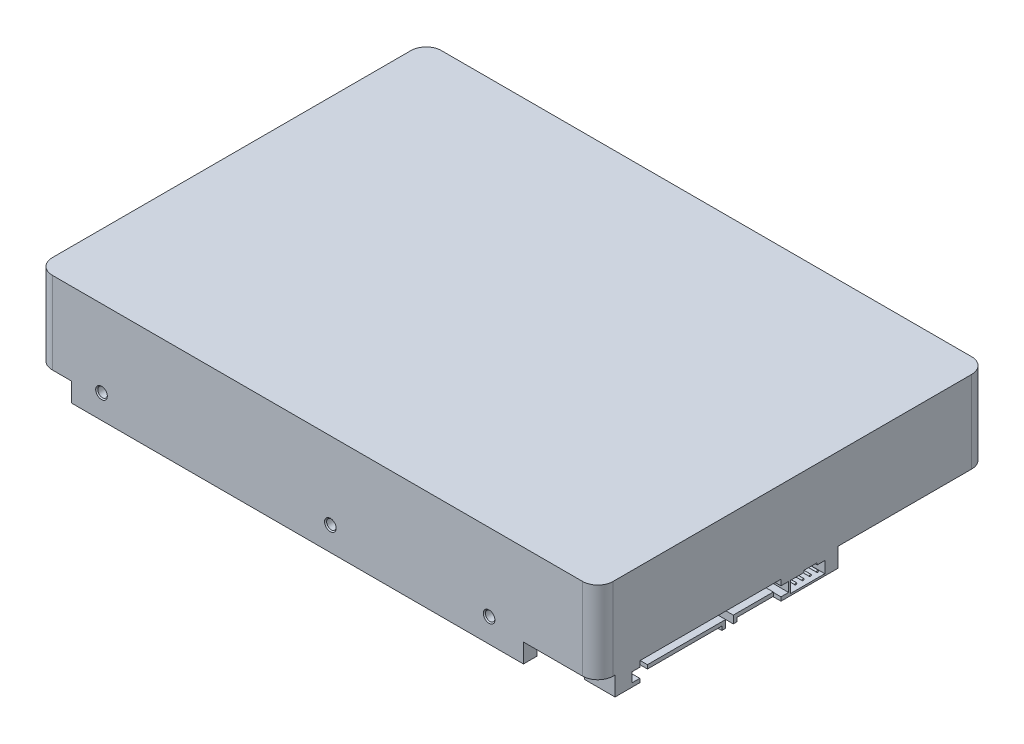
from build123d import *

# Parameters (mm, degrees)
SKETCH_2_W                  = 147
SKETCH_2_H                  = 102
EXTRUDE_1_DEPTH             = 26.5
SKETCH_4_W                  = 6
SKETCH_4_H                  = 3
CUT_EXTRUDE_2_DEPTH         = 9
PATTERN_LINEAR_1_COUNT      = 2
PATTERN_LINEAR_1_PITCH      = 41.61
PATTERN_LINEAR_1_COL_COUNT  = 2
PATTERN_LINEAR_1_COL_PITCH  = 101.6
MIRROR_1_COPY_1_SKETCH_W    = 6
MIRROR_1_COPY_1_SKETCH_H    = 3
MIRROR_1_COPY_1_DEPTH       = 9
MIRROR_1_COPY_2_SKETCH_W    = 6
MIRROR_1_COPY_2_SKETCH_H    = 3
MIRROR_1_COPY_2_DEPTH       = 9
HOLE_WIZARD_M3_1_AT_2_COUNT = 2
HOLE_WIZARD_M3_1_AT_2_PITCH = 37.773753222
PATTERN_LINEAR_2_COUNT      = 2
PATTERN_LINEAR_2_PITCH      = 41.61
PATTERN_LINEAR_2_COL_COUNT  = 2
PATTERN_LINEAR_2_COL_PITCH  = 101.6
PATTERN_LINEAR_4_COUNT      = 2
PATTERN_LINEAR_4_PITCH      = 44.45
PATTERN_LINEAR_4_COUNT_DIR2 = 2
PATTERN_LINEAR_4_PITCH_DIR2 = 95
SKETCH_3_W                  = 9
SKETCH_3_H                  = 5
CUT_EXTRUDE_1_DEPTH         = 129.485407732
CUT_EXTRUDE_8_DEPTH         = 5
CUT_EXTRUDE_9_DEPTH         = 0.5
SKETCH_12_W                 = 5
SKETCH_12_H                 = 37
CUT_EXTRUDE_10_DEPTH        = 5
SKETCH_13_W                 = 3
SKETCH_13_H                 = 2.5
CUT_EXTRUDE_11_DEPTH        = 8
EXTRUDE_2_DEPTH             = 5
CUT_EXTRUDE_12_DEPTH        = 5
SKETCH_16_W                 = 4.5
SKETCH_16_H                 = 1
EXTRUDE_3_DEPTH             = 0.1
PATTERN_LINEAR_5_COUNT      = 15
PATTERN_LINEAR_5_PITCH      = 1.3
SKETCH_17_W                 = 4.5
SKETCH_17_H                 = 1
EXTRUDE_4_DEPTH             = 0.1
PATTERN_LINEAR_6_COUNT      = 7
PATTERN_LINEAR_6_PITCH      = 1.3
SKETCH_18_R                 = 0.25
EXTRUDE_5_DEPTH             = 5
PATTERN_LINEAR_7_COUNT      = 4
PATTERN_LINEAR_7_PITCH      = 1.9
FILLET_1_R                  = 4
CHAMFER_1_SIZE              = 0.1


with BuildPart() as part:
    # 草图2 → 凸台-拉伸1 (new body)
    with BuildSketch(Plane(origin=(0, 0, 0), x_dir=(1, 0, 0), z_dir=(0, 1, 0))):
        Rectangle(SKETCH_2_W, SKETCH_2_H)
    extrude(amount=EXTRUDE_1_DEPTH)

    # 草图4 → 切除-拉伸2 (cut)
    with BuildSketch(Plane.XZ):
        with Locations((45, 46)):
            Rectangle(SKETCH_4_W, SKETCH_4_H)
    cut_extrude_2 = extrude(amount=-CUT_EXTRUDE_2_DEPTH, mode=Mode.SUBTRACT)

    # 阵列(线性)1: 切除-拉伸2 ×2
    with Locations(*[(-i * PATTERN_LINEAR_1_PITCH, 0, 0) for i in range(1, PATTERN_LINEAR_1_COUNT)]):
        add(cut_extrude_2, mode=Mode.SUBTRACT)

    # 阵列(线性)1 col: 切除-拉伸2 ×2
    with Locations(*[(-i * PATTERN_LINEAR_1_COL_PITCH, 0, 0) for i in range(1, PATTERN_LINEAR_1_COL_COUNT)]):
        add(cut_extrude_2, mode=Mode.SUBTRACT)

    # 镜向1: 切除-拉伸2 across plane
    add(cut_extrude_2.mirror(Plane.XY), mode=Mode.SUBTRACT)

    # 镜向1 copy 1 sketch → 镜向1 copy 1 (cut)
    with BuildSketch(Plane(origin=(-41.61, 0, 0), x_dir=(1, 0, 0), z_dir=(0, -1, 0))):
        with Locations((45, -46)):
            Rectangle(MIRROR_1_COPY_1_SKETCH_W, MIRROR_1_COPY_1_SKETCH_H)
    extrude(amount=-MIRROR_1_COPY_1_DEPTH, mode=Mode.SUBTRACT)

    # 镜向1 copy 2 sketch → 镜向1 copy 2 (cut)
    with BuildSketch(Plane(origin=(-101.6, 0, 0), x_dir=(1, 0, 0), z_dir=(0, -1, 0))):
        with Locations((45, -46)):
            Rectangle(MIRROR_1_COPY_2_SKETCH_W, MIRROR_1_COPY_2_SKETCH_H)
    extrude(amount=-MIRROR_1_COPY_2_DEPTH, mode=Mode.SUBTRACT)

    # 草图6 → M3 螺纹孔1 (revolve, cut)
    with BuildSketch(Plane(origin=(45, 6.25, 51), x_dir=(0, -1, 0), z_dir=(1, 0, 0))):
        Polygon((0, 0), (0, 4.751075774), (1.25, 4), (1.25, 0.275), (1.525, 0), align=None)
    hole_wizard_m3_1 = revolve(axis=Axis((45, 6.25, 57.35), (0, 0, -1)), mode=Mode.SUBTRACT)

    # M3 螺纹孔1 at 2: M3 螺纹孔1 ×2
    with Locations(*[Vector(0.07684027129931902, 0.9970434156578374, 0) * (i * HOLE_WIZARD_M3_1_AT_2_PITCH) for i in range(1, HOLE_WIZARD_M3_1_AT_2_COUNT)]):
        add(hole_wizard_m3_1, mode=Mode.SUBTRACT)

    # 阵列(线性)2: M3 螺纹孔1 ×2
    with Locations(*[(-i * PATTERN_LINEAR_2_PITCH, 0, 0) for i in range(1, PATTERN_LINEAR_2_COUNT)]):
        add(hole_wizard_m3_1, mode=Mode.SUBTRACT)

    # 阵列(线性)2 copy 1 sketch → 阵列(线性)2 copy 1 (revolve, cut)
    with BuildSketch(Plane(origin=(6.292545446, 43.912071935, 51), x_dir=(0, -1, 0), z_dir=(1, 0, 0))):
        Polygon((0, 0), (0, 4.751075774), (1.25, 4), (1.25, 0.275), (1.525, 0), align=None)
    revolve(axis=Axis((6.292545446, 43.912071935, 57.35), (0, 0, -1)), mode=Mode.SUBTRACT)

    # 阵列(线性)2 col: M3 螺纹孔1 ×2
    with Locations(*[(-i * PATTERN_LINEAR_2_COL_PITCH, 0, 0) for i in range(1, PATTERN_LINEAR_2_COL_COUNT)]):
        add(hole_wizard_m3_1, mode=Mode.SUBTRACT)

    # 阵列(线性)2 col copy 1 sketch → 阵列(线性)2 col copy 1 (revolve, cut)
    with BuildSketch(Plane(origin=(-53.697454554, 43.912071935, 51), x_dir=(0, -1, 0), z_dir=(1, 0, 0))):
        Polygon((0, 0), (0, 4.751075774), (1.25, 4), (1.25, 0.275), (1.525, 0), align=None)
    revolve(axis=Axis((-53.697454554, 43.912071935, 57.35), (0, 0, -1)), mode=Mode.SUBTRACT)

    # 镜向2: M3 螺纹孔1 across plane
    add(hole_wizard_m3_1.mirror(Plane.XY), mode=Mode.SUBTRACT)

    # 镜向2 copy 1 sketch → 镜向2 copy 1 (revolve, cut)
    with BuildSketch(Plane(origin=(47.902545446, 43.912071935, -51), x_dir=(0, -1, 0), z_dir=(1, 0, 0))):
        Polygon((0, 0), (0, -4.751075774), (1.25, -4), (1.25, -0.275), (1.525, 0), align=None)
    revolve(axis=Axis((47.902545446, 43.912071935, -57.35), (0, 0, -1)), mode=Mode.SUBTRACT)

    # 镜向2 copy 2 sketch → 镜向2 copy 2 (revolve, cut)
    with BuildSketch(Plane(origin=(3.39, 6.25, -51), x_dir=(0, -1, 0), z_dir=(1, 0, 0))):
        Polygon((0, 0), (0, -4.751075774), (1.25, -4), (1.25, -0.275), (1.525, 0), align=None)
    revolve(axis=Axis((3.39, 6.25, -57.35), (0, 0, -1)), mode=Mode.SUBTRACT)

    # 镜向2 copy 3 sketch → 镜向2 copy 3 (revolve, cut)
    with BuildSketch(Plane(origin=(6.292545446, 43.912071935, -51), x_dir=(0, -1, 0), z_dir=(1, 0, 0))):
        Polygon((0, 0), (0, -4.751075774), (1.25, -4), (1.25, -0.275), (1.525, 0), align=None)
    revolve(axis=Axis((6.292545446, 43.912071935, -57.35), (0, 0, -1)), mode=Mode.SUBTRACT)

    # 镜向2 copy 4 sketch → 镜向2 copy 4 (revolve, cut)
    with BuildSketch(Plane(origin=(-56.6, 6.25, -51), x_dir=(0, -1, 0), z_dir=(1, 0, 0))):
        Polygon((0, 0), (0, -4.751075774), (1.25, -4), (1.25, -0.275), (1.525, 0), align=None)
    revolve(axis=Axis((-56.6, 6.25, -57.35), (0, 0, -1)), mode=Mode.SUBTRACT)

    # 镜向2 copy 5 sketch → 镜向2 copy 5 (revolve, cut)
    with BuildSketch(Plane(origin=(-53.697454554, 43.912071935, -51), x_dir=(0, -1, 0), z_dir=(1, 0, 0))):
        Polygon((0, 0), (0, -4.751075774), (1.25, -4), (1.25, -0.275), (1.525, 0), align=None)
    revolve(axis=Axis((-53.697454554, 43.912071935, -57.35), (0, 0, -1)), mode=Mode.SUBTRACT)

    # 草图9 → M3 螺纹孔2 (revolve, cut)
    with BuildSketch(Plane(origin=(32.22, 0, 47.5), x_dir=(0, 0, -1), z_dir=(1, 0, 0))):
        Polygon((0, 0), (0, 10.751075774), (1.25, 10), (1.25, 0.275), (1.525, 0), align=None)
    hole_wizard_m3_2 = revolve(axis=Axis((32.22, -6.35, 47.5), (0, 1, 0)), mode=Mode.SUBTRACT)

    # 阵列(线性)4: Hole Wizard M3 _2 2 × 2
    with Locations(*[(-i * PATTERN_LINEAR_4_PITCH, 0, -j * PATTERN_LINEAR_4_PITCH_DIR2) for i in range(PATTERN_LINEAR_4_COUNT) for j in range(PATTERN_LINEAR_4_COUNT_DIR2) if (i, j) != (0, 0)]):
        add(hole_wizard_m3_2, mode=Mode.SUBTRACT)

    # 草图3 → 切除-拉伸1 (cut, through all)
    with BuildSketch(Plane.XY.offset(51)):
        with Locations((-69, 2.5)):
            Rectangle(SKETCH_3_W, SKETCH_3_H)
    extrude(amount=-CUT_EXTRUDE_1_DEPTH, mode=Mode.SUBTRACT)

    # 草图10 → 切除-拉伸8 (cut)
    with BuildSketch(Plane.XZ):
        with BuildLine():
            Line((-64.5, 47.5), (-15.73, 47.5))
            ThreePointArc((-15.73, 47.5), (-12.23, 44), (-8.73, 47.5))
            Line((-8.73, 47.5), (4.246353463, 47.5))
            Line((4.246353463, 47.5), (28.72, 47.5))
            ThreePointArc((28.72, 47.5), (32.22, 44), (35.72, 47.5))
            Line((35.72, 47.5), (54, 47.5))
            Line((54, 47.5), (54, 51))
            Line((54, 51), (73.5, 51))
            Line((73.5, 51), (73.5, 46.5))
            Line((73.5, 46.5), (36.607482194, 46.5))
            ThreePointArc((36.607482194, 46.5), (32.22, 43), (27.832517806, 46.5))
            Line((27.832517806, 46.5), (7.5, 46.5))
            Line((7.5, 46.5), (7.5, -34.5))
            Line((7.5, -34.5), (32.5, -34.5))
            Line((32.5, -34.5), (38.5, -28.5))
            Line((38.5, -28.5), (65.5, -28.5))
            Line((65.5, -28.5), (65.5, -12))
            Line((65.5, -12), (73.5, -12))
            Line((73.5, -12), (73.5, -51))
            Line((73.5, -51), (54, -51))
            Line((54, -51), (54, -47.5))
            Line((54, -47.5), (35.72, -47.5))
            ThreePointArc((35.72, -47.5), (32.22, -44), (28.72, -47.5))
            Line((28.72, -47.5), (-8.73, -47.5))
            ThreePointArc((-8.73, -47.5), (-12.23, -44), (-15.73, -47.5))
            Line((-15.73, -47.5), (-64.5, -47.5))
            Line((-64.5, -47.5), (-64.5, 47.5))
        make_face()
    extrude(amount=-CUT_EXTRUDE_8_DEPTH, mode=Mode.SUBTRACT)

    # 草图11 → 切除-拉伸9 (cut)
    with BuildSketch(Plane.XZ):
        with BuildLine():
            Line((65.5, 46.5), (36.607482194, 46.5))
            ThreePointArc((36.607482194, 46.5), (32.22, 43), (27.832517806, 46.5))
            Line((27.832517806, 46.5), (7.5, 46.5))
            Line((7.5, 46.5), (7.5, -34.5))
            Line((7.5, -34.5), (65.5, -34.5))
            Line((65.5, -34.5), (65.5, -12))
            Line((65.5, -12), (61.5, -12))
            Line((61.5, -12), (61.5, -9.5))
            Line((61.5, -9.5), (65.5, -9.5))
            Line((65.5, -9.5), (65.5, -0.5))
            Line((65.5, -0.5), (61.5, -0.5))
            Line((61.5, -0.5), (61.5, 3))
            Line((61.5, 3), (65.5, 3))
            Line((65.5, 3), (65.5, 15.5))
            Line((65.5, 15.5), (64, 15.5))
            Line((64, 15.5), (64, 17.5))
            Line((64, 17.5), (65.5, 17.5))
            Line((65.5, 17.5), (65.5, 38.5))
            Line((65.5, 38.5), (61.5, 38.5))
            Line((61.5, 38.5), (61.5, 42.5))
            Line((61.5, 42.5), (65.5, 42.5))
            Line((65.5, 42.5), (65.5, 46.5))
        make_face()
    extrude(amount=-CUT_EXTRUDE_9_DEPTH, mode=Mode.SUBTRACT)

    # 草图12 → 切除-拉伸10 (cut)
    with BuildSketch(Plane.XZ):
        with Locations((71, 21.5)):
            Rectangle(SKETCH_12_W, SKETCH_12_H)
    extrude(amount=-CUT_EXTRUDE_10_DEPTH, mode=Mode.SUBTRACT)

    # 草图13 → 切除-拉伸11 (cut)
    with BuildSketch(Plane(origin=(73.5, 0, 0), x_dir=(0, 0, -1), z_dir=(1, 0, 0))):
        with Locations((-40.5, 2.25)):
            Rectangle(SKETCH_13_W, SKETCH_13_H)
        with Locations((-2.5, 2.25)):
            Rectangle(SKETCH_13_W, SKETCH_13_H)
    extrude(amount=-CUT_EXTRUDE_11_DEPTH, mode=Mode.SUBTRACT)

    # 草图14 → 凸台-拉伸2 (add)
    with BuildSketch(Plane(origin=(68.5, 0, 0), x_dir=(0, 0, -1), z_dir=(1, 0, 0))):
        Polygon((-15.5, 3.1), (-5, 3.1), (-5, 2.1), (-14.5, 2.1), (-14.5, 1.1), (-15.5, 1.1), align=None)
        Polygon((-38, 3.1), (-17.5, 3.1), (-17.5, 1.1), (-18.5, 1.1), (-18.5, 2.1), (-38, 2.1), align=None)
    extrude(amount=EXTRUDE_2_DEPTH)

    # 草图15 → 切除-拉伸12 (cut)
    with BuildSketch(Plane(origin=(73.5, 0, 0), x_dir=(0, 0, -1), z_dir=(1, 0, 0))):
        Polygon((6.5, 3.5), (8.5, 3.5), (8.5, 0.5), (-0.5, 0.5), (-0.5, 3.5), (3, 3.5), (3, 4), (6.5, 4), align=None)
    extrude(amount=-CUT_EXTRUDE_12_DEPTH, mode=Mode.SUBTRACT)

    # 草图16 → 凸台-拉伸3 (add)
    with BuildSketch(Plane.XZ.offset(-2.1)):
        with Locations((70.75, 37.4)):
            Rectangle(SKETCH_16_W, SKETCH_16_H)
    extrude_3 = extrude(amount=EXTRUDE_3_DEPTH)

    # 阵列(线性)5: 凸台-拉伸3 ×15
    with Locations(*[(0, 0, -i * PATTERN_LINEAR_5_PITCH) for i in range(1, PATTERN_LINEAR_5_COUNT)]):
        add(extrude_3)

    # 草图17 → 凸台-拉伸4 (add)
    with BuildSketch(Plane.XZ.offset(-2.1)):
        with Locations((70.75, 5.9)):
            Rectangle(SKETCH_17_W, SKETCH_17_H)
    extrude_4 = extrude(amount=EXTRUDE_4_DEPTH)

    # 阵列(线性)6: 凸台-拉伸4 ×7
    with Locations(*[(0, 0, i * PATTERN_LINEAR_6_PITCH) for i in range(1, PATTERN_LINEAR_6_COUNT)]):
        add(extrude_4)

    # 草图18 → 凸台-拉伸5 (add)
    with BuildSketch(Plane(origin=(68.5, 0, 0), x_dir=(0, 0, -1), z_dir=(1, 0, 0))):
        with Locations(Location((0.9, 2, 0), (0, 0, 180))):
            Circle(SKETCH_18_R)
    extrude_5 = extrude(amount=EXTRUDE_5_DEPTH)

    # 阵列(线性)7: 凸台-拉伸5 ×4
    with Locations(*[(0, 0, -i * PATTERN_LINEAR_7_PITCH) for i in range(1, PATTERN_LINEAR_7_COUNT)]):
        add(extrude_5)

    # 圆角1
    fillet_1_edges = [part.edges().sort_by_distance(p)[0] for p in [
        (-73.5, 15.75, -51),
        (73.5, 15.75, -51),
        (73.5, 15.75, 51),
        (-73.5, 15.75, 51),
    ]]
    fillet(fillet_1_edges, radius=FILLET_1_R)

    # 倒角1
    chamfer_1_edges = [part.edges().sort_by_distance(p)[0] for p in [
        (73, 2, 19.2),
        (73, 2, 20.5),
        (73, 2, 21.8),
        (73, 2, 23.1),
        (73, 2, 24.4),
        (73, 2, 25.7),
        (73, 2, 27),
        (73, 2, 28.3),
        (73, 2, 29.6),
        (73, 2, 30.9),
        (73, 2, 32.2),
        (73, 2, 33.5),
        (73, 2, 34.8),
        (73, 2, 36.1),
        (73, 2, 37.4),
        (73, 2, 13.7),
        (73, 2, 12.4),
        (73, 2, 11.1),
        (73, 2, 9.8),
        (73, 2, 8.5),
        (73, 2, 7.2),
        (73, 2, 5.9),
    ]]
    chamfer(chamfer_1_edges, length=CHAMFER_1_SIZE - 0.0001)  # a hair under: the kernel refuses the full size


solid = part.part
